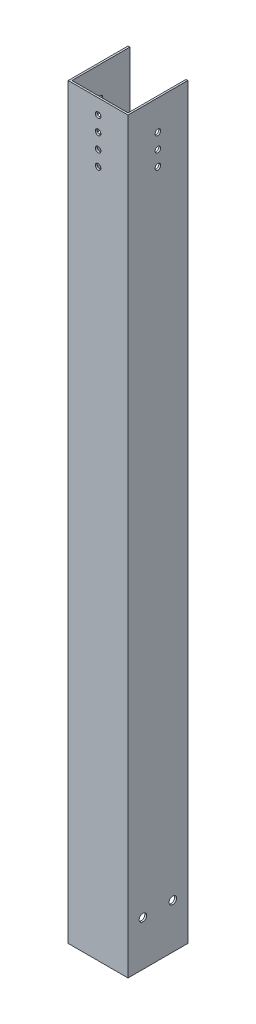
from build123d import *

# Parameters (mm, degrees)
BOSS_EXTRUDE1_DEPTH = 635
SKETCH2_R           = 3.175
SKETCH2_R_2         = 2.38125
CUT_EXTRUDE1_DEPTH  = 640.051077771
SKETCH3_R           = 2.38125
CUT_EXTRUDE2_DEPTH  = 640.051077771


with BuildPart() as part:
    # Sketch1 → Boss-Extrude1 (new body)
    with BuildSketch(Plane(origin=(0, 0, 0), x_dir=(1, 0, 0), z_dir=(0, 1, 0))):
        Polygon((0, 0), (50.8, 0), (50.8, 50.8), (49.2125, 50.8), (49.2125, 1.5875), (1.5875, 1.5875), (1.5875, 50.8), (0, 50.8), align=None)
    extrude(amount=BOSS_EXTRUDE1_DEPTH)

    # Sketch2 → Cut-Extrude1 (cut, through all)
    with BuildSketch(Plane(origin=(50.8, 0, 0), x_dir=(0, 0, -1), z_dir=(1, 0, 0))):
        with Locations((12.7, 38.1)):
            Circle(SKETCH2_R)
        with Locations((38.1, 38.1)):
            Circle(SKETCH2_R)
        with Locations((25.4, 609.6)):
            Circle(SKETCH2_R_2)
        with Locations((25.4, 596.9)):
            Circle(SKETCH2_R_2)
        with Locations((25.4, 584.2)):
            Circle(SKETCH2_R_2)
    extrude(amount=-CUT_EXTRUDE1_DEPTH, mode=Mode.SUBTRACT)

    # Sketch3 → Cut-Extrude2 (cut, through all)
    with BuildSketch(Plane.XY):
        with Locations((25.4, 622.3)):
            Circle(SKETCH3_R)
        with Locations((25.4, 609.6)):
            Circle(SKETCH3_R)
        with Locations((25.4, 596.9)):
            Circle(SKETCH3_R)
        with Locations((25.4, 584.2)):
            Circle(SKETCH3_R)
    extrude(amount=-CUT_EXTRUDE2_DEPTH, mode=Mode.SUBTRACT)


solid = part.part
